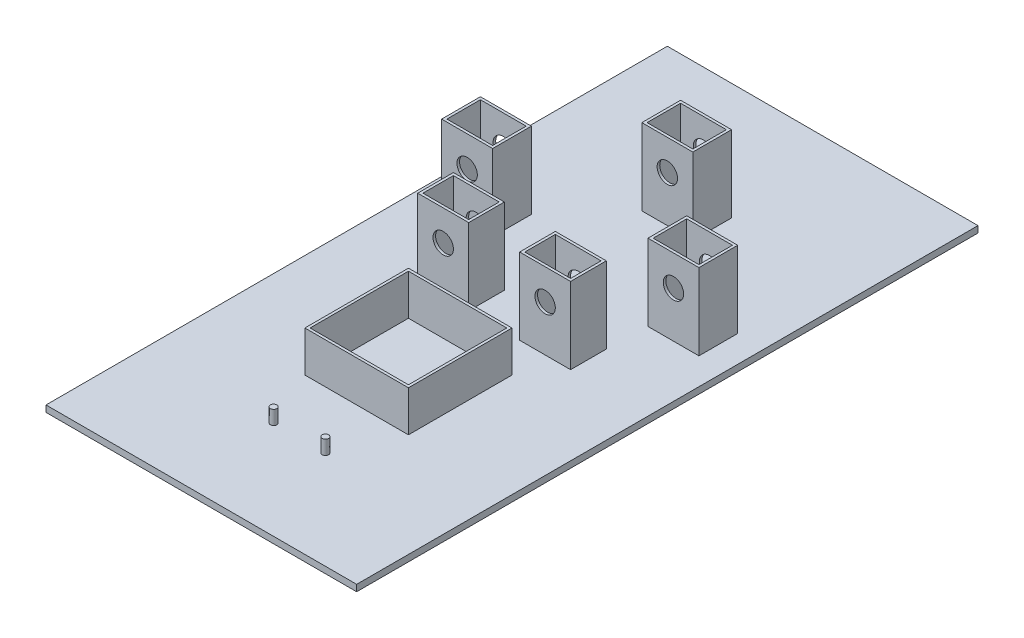
from build123d import *

# Parameters (mm, degrees)
SKETCH1_W           = 304.8
SKETCH1_H           = 609.6
BOSS_EXTRUDE1_DEPTH = 6.35
SKETCH2_W           = 50
SKETCH2_H           = 38
BOSS_EXTRUDE2_DEPTH = 75
SKETCH4_W           = 50.000000076
SKETCH4_H           = 37.999999946
BOSS_EXTRUDE3_DEPTH = 75
SKETCH5_W           = 50
SKETCH5_H           = 35
BOSS_EXTRUDE4_DEPTH = 75
SHELL11_T           = -2.54
SKETCH3_R           = 10
CUT_EXTRUDE2_DEPTH  = 75
SKETCH6_R           = 10
CUT_EXTRUDE3_DEPTH  = 75
SKETCH7_R           = 10
CUT_EXTRUDE4_DEPTH  = 75
SKETCH8_W           = 101.6
SKETCH8_H           = 101.6
BOSS_EXTRUDE5_DEPTH = 40
SHELL12_START       = 6.35
SHELL12_OUTLINE_W   = 96.52
SHELL12_OUTLINE_H   = 96.52
SHELL12_DEPTH       = 40
SKETCH9_R           = 3.16
BOSS_EXTRUDE6_DEPTH = 13.8176


# Read off the part's stored shape, not the designer's step: Shell12
with BuildPart() as part:
    # Sketch1 → Boss-Extrude1 (new body)
    with BuildSketch(Plane(origin=(0, 0, 0), x_dir=(1, 0, 0), z_dir=(0, 1, 0))):
        Rectangle(SKETCH1_W, SKETCH1_H)
    extrude(amount=BOSS_EXTRUDE1_DEPTH)

    # Sketch2 → Boss-Extrude2 (add)
    with BuildSketch(Plane(origin=(0, 6.35, 0), x_dir=(1, 0, 0), z_dir=(0, 1, 0))):
        with Locations((0, 171.4)):
            Rectangle(SKETCH2_W, SKETCH2_H)
    extrude(amount=BOSS_EXTRUDE2_DEPTH)

    # Sketch4 → Boss-Extrude3 (add)
    with BuildSketch(Plane(origin=(0, 6.35, 0), x_dir=(1, 0, 0), z_dir=(0, 1, 0))):
        with Locations((-101.200000038, 76.2)):
            Rectangle(SKETCH4_W, SKETCH4_H)
    boss_extrude3 = extrude(amount=BOSS_EXTRUDE3_DEPTH)

    # Sketch5 → Boss-Extrude4 (add)
    with BuildSketch(Plane(origin=(0, 6.35, 0), x_dir=(1, 0, 0), z_dir=(0, 1, 0))):
        with Locations((-50, 0)):
            Rectangle(SKETCH5_W, SKETCH5_H)
    boss_extrude4 = extrude(amount=BOSS_EXTRUDE4_DEPTH)

    # Mirror1: Boss-Extrude3, Boss-Extrude4 across plane
    add(boss_extrude3.mirror(Plane(origin=(0, 0, 0), x_dir=(0, 0, 1), z_dir=(1, 0, 0))))
    add(boss_extrude4.mirror(Plane(origin=(0, 0, 0), x_dir=(0, 0, 1), z_dir=(1, 0, 0))))

    # Shell11
    shell11_openings = [part.faces().sort_by_distance(p)[0] for p in [
        (0, 81.35, -171.4),
        (-101.200000038, 81.35, -76.2),
        (-50, 81.35, 0),
        (101.200000038, 81.35, -76.2),
        (50, 81.35, 0),
    ]]
    offset(amount=SHELL11_T, openings=shell11_openings, kind=Kind.INTERSECTION)

    # Sketch3 → Cut-Extrude2 (cut)
    with BuildSketch(Plane.XY.offset(-152.4)):
        with Locations((0, 51.35)):
            Circle(SKETCH3_R)
    extrude(amount=-CUT_EXTRUDE2_DEPTH, mode=Mode.SUBTRACT)

    # Sketch6 → Cut-Extrude3 (cut)
    with BuildSketch(Plane.XY.offset(-57.200000027)):
        with Locations((-101.2, 51.35)):
            Circle(SKETCH6_R)
    cut_extrude3 = extrude(amount=-CUT_EXTRUDE3_DEPTH, mode=Mode.SUBTRACT)

    # Sketch7 → Cut-Extrude4 (cut)
    with BuildSketch(Plane.XY.offset(17.5)):
        with Locations((-50, 51.35)):
            Circle(SKETCH7_R)
    cut_extrude4 = extrude(amount=-CUT_EXTRUDE4_DEPTH, mode=Mode.SUBTRACT)

    # Mirror2: Cut-Extrude3, Cut-Extrude4 across plane
    add(cut_extrude3.mirror(Plane(origin=(0, 0, 0), x_dir=(0, 0, 1), z_dir=(1, 0, 0))), mode=Mode.SUBTRACT)
    add(cut_extrude4.mirror(Plane(origin=(0, 0, 0), x_dir=(0, 0, 1), z_dir=(1, 0, 0))), mode=Mode.SUBTRACT)

    # Sketch8 → Boss-Extrude5 (add)
    with BuildSketch(Plane(origin=(0, 6.35, 0), x_dir=(1, 0, 0), z_dir=(0, 1, 0))):
        with Locations((0, -101.6)):
            Rectangle(SKETCH8_W, SKETCH8_H)
    extrude(amount=BOSS_EXTRUDE5_DEPTH)

    # Shell12 outline → Shell12 (cut)
    with BuildSketch(Plane(origin=(0, 0, 0), x_dir=(1, 0, 0), z_dir=(0, 1, 0)).offset(SHELL12_START)):
        with Locations((0, -101.6)):
            Rectangle(SHELL12_OUTLINE_W, SHELL12_OUTLINE_H)
    extrude(amount=SHELL12_DEPTH, mode=Mode.SUBTRACT)

    # Sketch9 → Boss-Extrude6 (add)
    with BuildSketch(Plane(origin=(0, 6.35, 0), x_dir=(1, 0, 0), z_dir=(0, 1, 0))):
        with Locations(Location((-25.4, -208.456082319, 0), (0, 0, 90))):
            Circle(SKETCH9_R)
    boss_extrude6 = extrude(amount=BOSS_EXTRUDE6_DEPTH)

    # Mirror3: Boss-Extrude6 across plane
    add(boss_extrude6.mirror(Plane(origin=(0, 0, 0), x_dir=(0, 0, 1), z_dir=(1, 0, 0))))


solid = part.part
